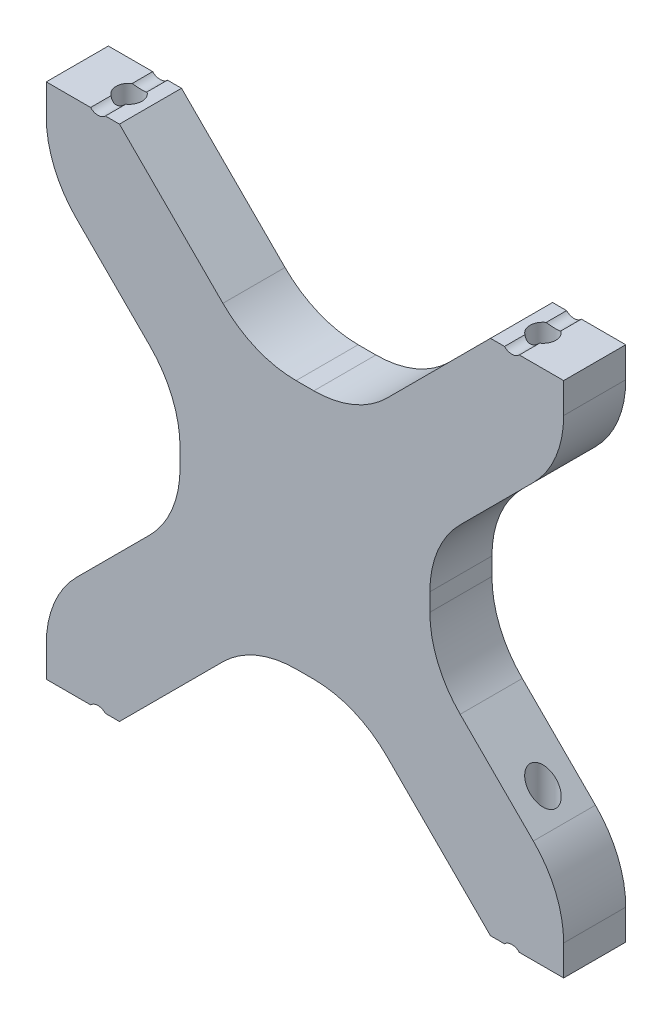
from build123d import *

# Parameters (mm, degrees)
EXTRUDE_1_DEPTH        = 6
CUT_EXTRUDE_1_DEPTH    = 42.104177289
FILLET_1_R             = 2
FILLET_1_OF_MIRROR_3_R = 2
SKETCH_3_R             = 1.25
CUT_EXTRUDE_2_DEPTH    = 59.233427122
SKETCH_4_W             = 4.242640687
SKETCH_4_H             = 50
CUT_EXTRUDE_3_DEPTH    = 39.937540248
FILLET_2_R             = 10


with BuildPart() as part:
    # ｽｹｯﾁ1 → ﾎﾞｽ - 押し出し1 (new body)
    with BuildSketch(Plane.XY):
        Polygon((-32.071067812, 25), (-12.071067812, 5), (-12.071067812, -5), (-32.071067812, -25), (-17.928932188, -25), (-5, -12.071067812), (5, -12.071067812), (17.928932188, -25), (32.071067812, -25), (12.071067812, -5), (12.071067812, 5), (32.071067812, 25), (17.928932188, 25), (5, 12.071067812), (-5, 12.071067812), (-17.928932188, 25), align=None)
    extrude(amount=EXTRUDE_1_DEPTH)

    # ｽｹｯﾁ2 → ｶｯﾄ - 押し出し1 (cut, through all)
    with BuildSketch(Plane.XY.offset(6)):
        with BuildLine():
            Line((-20.714142843, 25), (-19.285857157, 25))
            ThreePointArc((-19.285857157, 25), (-20, 24.7), (-20.714142843, 25))
        make_face()
        with BuildLine():
            Line((20.714142843, 25), (19.285857157, 25))
            ThreePointArc((19.285857157, 25), (20, 24.7), (20.714142843, 25))
        make_face()
    cut_extrude_1 = extrude(amount=-CUT_EXTRUDE_1_DEPTH, mode=Mode.SUBTRACT)

    # ﾌｨﾚｯﾄ1
    fillet_1_edges = [part.edges().sort_by_distance(p)[0] for p in [
        (32.071067812, 25, 3),
        (-32.071067812, 25, 3),
    ]]
    fillet(fillet_1_edges, radius=FILLET_1_R)

    # ﾐﾗｰ3: ｶｯﾄ - 押し出し1 across plane
    add(cut_extrude_1.mirror(Plane.ZX), mode=Mode.SUBTRACT)

    # ﾌｨﾚｯﾄ1 of ﾐﾗｰ3
    fillet_1_of_mirror_3_edges = [part.edges().sort_by_distance(p)[0] for p in [
        (32.071067812, -25, 3),
        (-32.071067812, -25, 3),
    ]]
    fillet(fillet_1_of_mirror_3_edges, radius=FILLET_1_OF_MIRROR_3_R)

    # ｽｹｯﾁ3 → ｶｯﾄ - 押し出し2 (cut, through all)
    with BuildSketch(Plane(origin=(0, 25, 0), x_dir=(1, 0, 0), z_dir=(0, 1, 0))):
        with Locations((-20, -3)):
            Circle(SKETCH_3_R)
        with Locations((20, -3)):
            Circle(SKETCH_3_R)
    extrude(amount=-CUT_EXTRUDE_2_DEPTH, mode=Mode.SUBTRACT)

    # ｽｹｯﾁ4 → ｶｯﾄ - 押し出し3 (cut, through all)
    with BuildSketch(Plane.XY.offset(6)):
        with Locations((-27.121320344, 0)):
            Rectangle(SKETCH_4_W, SKETCH_4_H)
        with Locations((27.121320344, 0)):
            Rectangle(SKETCH_4_W, SKETCH_4_H)
    extrude(amount=-CUT_EXTRUDE_3_DEPTH, mode=Mode.SUBTRACT)

    # ﾌｨﾚｯﾄ2
    fillet_2_edges = [part.edges().sort_by_distance(p)[0] for p in [
        (25, 17.928932188, 3),
        (12.071067812, 5, 3),
        (12.071067812, -5, 3),
        (25, -17.928932188, 3),
        (5, -12.071067812, 3),
        (-5, -12.071067812, 3),
        (-25, -17.928932188, 3),
        (-12.071067812, -5, 3),
        (-12.071067812, 5, 3),
        (-25, 17.928932188, 3),
        (5, 12.071067812, 3),
        (-5, 12.071067812, 3),
    ]]
    fillet(fillet_2_edges, radius=FILLET_2_R)


solid = part.part
